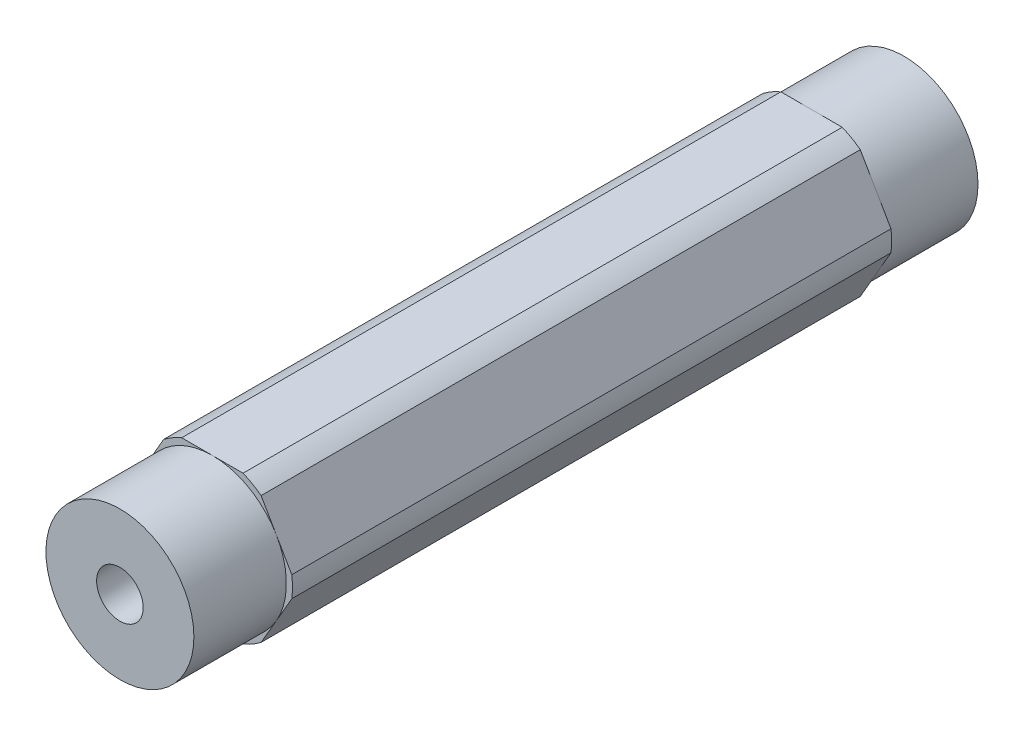
from build123d import *

# Parameters (mm, degrees)
SKETCH1_R           = 2.000000064
BOSS_EXTRUDE1_DEPTH = 25.7175
SKETCH4_R           = 6.35
SKETCH4_R_2         = 2.000000064
BOSS_EXTRUDE2_DEPTH = 7.9375


with BuildPart() as part:
    # Sketch1 → Boss-Extrude1 (new, symmetric)
    with BuildSketch(Plane.XY):
        with BuildLine():
            ThreePointArc((4.181770846, 5.456960429), (3.437499983, 5.953924622), (2.634980936, 6.35))
            Line((2.634980936, 6.35), (-2.634980936, 6.35))
            ThreePointArc((-2.634980936, 6.35), (-3.437499983, 5.953924622), (-4.181770846, 5.456960429))
            Line((-4.181770846, 5.456960429), (-6.816751782, 0.893039571))
            ThreePointArc((-6.816751782, 0.893039571), (-6.874999966, 0), (-6.816751782, -0.893039571))
            Line((-6.816751782, -0.893039571), (-4.181770846, -5.456960429))
            ThreePointArc((-4.181770846, -5.456960429), (-3.437499983, -5.953924622), (-2.634980936, -6.35))
            Line((-2.634980936, -6.35), (2.634980936, -6.35))
            ThreePointArc((2.634980936, -6.35), (3.437499983, -5.953924622), (4.181770846, -5.456960429))
            Line((4.181770846, -5.456960429), (6.816751782, -0.893039571))
            ThreePointArc((6.816751782, -0.893039571), (6.860422465, -0.447468582), (6.874999966, 0))
            ThreePointArc((6.874999966, 0), (6.860422465, 0.447468582), (6.816751782, 0.893039571))
            Line((6.816751782, 0.893039571), (4.181770846, 5.456960429))
        make_face()
        Circle(SKETCH1_R, mode=Mode.SUBTRACT)
    extrude(amount=BOSS_EXTRUDE1_DEPTH, both=True)

    # Sketch4 → Boss-Extrude2 (add)
    with BuildSketch(Plane.XY.offset(25.7175)):
        Circle(SKETCH4_R)
        Circle(SKETCH4_R_2, mode=Mode.SUBTRACT)
    boss_extrude2 = extrude(amount=BOSS_EXTRUDE2_DEPTH)

    # Mirror1: Boss-Extrude2 across plane
    add(boss_extrude2.mirror(Plane.XY))


solid = part.part
